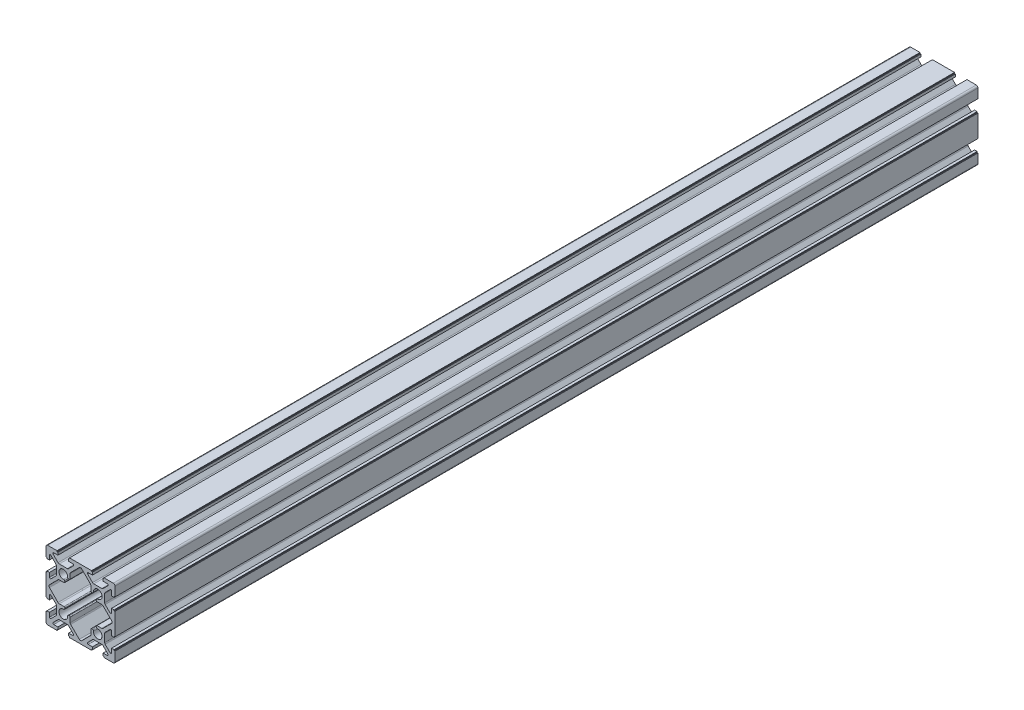
from build123d import *

# Parameters (mm, degrees)
EXTRUDE_1_DEPTH = 500


with BuildPart() as part:
    # 草图1 → 拉伸1 (new body)
    with BuildSketch(Plane.XY):
        with BuildLine():
            Line((29.173779204, 25.880575365), (26.320225813, 23.027021974))
            ThreePointArc((26.320225813, 23.027021974), (26.211839437, 22.482126867), (26.673779204, 22.173468583))
            Line((26.673779204, 22.173468583), (29.093880252, 22.173468583))
            Line((29.093880252, 22.173468583), (29.093880252, 20.673468583))
            Line((29.093880252, 20.673468583), (28.593880252, 20.673468583))
            Line((28.593880252, 20.673468583), (28.593880252, 20.173468583))
            Line((28.593880252, 20.173468583), (15.793880216, 20.173468583))
            Line((15.793880216, 20.173468583), (15.793880216, 20.673468583))
            Line((15.793880216, 20.673468583), (15.293880216, 20.673468583))
            Line((15.293880216, 20.673468583), (15.293880216, 22.173468583))
            Line((15.293880216, 22.173468583), (17.713981229, 22.173468583))
            ThreePointArc((17.713981229, 22.173468583), (18.175920995, 22.482126867), (18.06753462, 23.027021974))
            Line((18.06753462, 23.027021974), (15.213981229, 25.880575365))
            ThreePointArc((15.213981229, 25.880575365), (14.88955788, 26.097348116), (14.506874448, 26.173468583))
            Line((14.506874448, 26.173468583), (9.880885985, 26.173468583))
            ThreePointArc((9.880885985, 26.173468583), (9.498202552, 26.097348116), (9.173779204, 25.880575365))
            Line((9.173779204, 25.880575365), (6.320225813, 23.027021974))
            ThreePointArc((6.320225813, 23.027021974), (6.211839437, 22.482126867), (6.673779204, 22.173468583))
            Line((6.673779204, 22.173468583), (9.093880216, 22.173468583))
            Line((9.093880216, 22.173468583), (9.093880216, 20.673468583))
            Line((9.093880216, 20.673468583), (8.593880216, 20.673468583))
            Line((8.593880216, 20.673468583), (8.593880216, 20.173468583))
            Line((8.593880216, 20.173468583), (3.193880216, 20.173468583))
            ThreePointArc((3.193880216, 20.173468583), (2.486773435, 20.466361802), (2.193880216, 21.173468583))
            Line((2.193880216, 21.173468583), (2.193880216, 26.573468583))
            Line((2.193880216, 26.573468583), (2.693880216, 26.573468583))
            Line((2.693880216, 26.573468583), (2.693880216, 27.073468583))
            Line((2.693880216, 27.073468583), (4.193880216, 27.073468583))
            Line((4.193880216, 27.073468583), (4.193880216, 24.653367607))
            ThreePointArc((4.193880216, 24.653367607), (4.5025385, 24.191427841), (5.047433607, 24.299814216))
            Line((5.047433607, 24.299814216), (7.900986997, 27.153367607))
            ThreePointArc((7.900986997, 27.153367607), (8.117759749, 27.477790956), (8.193880216, 27.860474388))
            Line((8.193880216, 27.860474388), (8.193880216, 32.486462851))
            ThreePointArc((8.193880216, 32.486462851), (8.117759749, 32.869146283), (7.900986997, 33.193569632))
            Line((7.900986997, 33.193569632), (5.047433607, 36.047123023))
            ThreePointArc((5.047433607, 36.047123023), (4.5025385, 36.155509398), (4.193880216, 35.693569632))
            Line((4.193880216, 35.693569632), (4.193880216, 33.273468583))
            Line((4.193880216, 33.273468583), (2.693880216, 33.273468583))
            Line((2.693880216, 33.273468583), (2.693880216, 33.773468583))
            Line((2.693880216, 33.773468583), (2.193880216, 33.773468583))
            Line((2.193880216, 33.773468583), (2.193880216, 46.57346862))
            Line((2.193880216, 46.57346862), (2.693880216, 46.57346862))
            Line((2.693880216, 46.57346862), (2.693880216, 47.07346862))
            Line((2.693880216, 47.07346862), (4.193880216, 47.07346862))
            Line((4.193880216, 47.07346862), (4.193880216, 44.653367607))
            ThreePointArc((4.193880216, 44.653367607), (4.5025385, 44.191427841), (5.047433607, 44.299814216))
            Line((5.047433607, 44.299814216), (7.900986997, 47.153367607))
            ThreePointArc((7.900986997, 47.153367607), (8.117759749, 47.477790956), (8.193880216, 47.860474388))
            Line((8.193880216, 47.860474388), (8.193880216, 52.486462851))
            ThreePointArc((8.193880216, 52.486462851), (8.117759749, 52.869146283), (7.900986997, 53.193569632))
            Line((7.900986997, 53.193569632), (5.047433607, 56.047123023))
            ThreePointArc((5.047433607, 56.047123023), (4.5025385, 56.155509398), (4.193880216, 55.693569632))
            Line((4.193880216, 55.693569632), (4.193880216, 53.27346862))
            Line((4.193880216, 53.27346862), (2.693880216, 53.27346862))
            Line((2.693880216, 53.27346862), (2.693880216, 53.77346862))
            Line((2.693880216, 53.77346862), (2.193880216, 53.77346862))
            Line((2.193880216, 53.77346862), (2.193880216, 59.17346862))
            ThreePointArc((2.193880216, 59.17346862), (2.486773435, 59.880575401), (3.193880216, 60.17346862))
            Line((3.193880216, 60.17346862), (8.593880216, 60.17346862))
            Line((8.593880216, 60.17346862), (8.593880216, 59.67346862))
            Line((8.593880216, 59.67346862), (9.093880216, 59.67346862))
            Line((9.093880216, 59.67346862), (9.093880216, 58.17346862))
            Line((9.093880216, 58.17346862), (6.673779204, 58.17346862))
            ThreePointArc((6.673779204, 58.17346862), (6.211839437, 57.864810336), (6.320225813, 57.319915229))
            Line((6.320225813, 57.319915229), (9.173779204, 54.466361838))
            ThreePointArc((9.173779204, 54.466361838), (9.498202552, 54.249589087), (9.880885985, 54.17346862))
            Line((9.880885985, 54.17346862), (14.506874448, 54.17346862))
            ThreePointArc((14.506874448, 54.17346862), (14.88955788, 54.249589087), (15.213981229, 54.466361838))
            Line((15.213981229, 54.466361838), (18.06753462, 57.319915229))
            ThreePointArc((18.06753462, 57.319915229), (18.175920995, 57.864810336), (17.713981229, 58.17346862))
            Line((17.713981229, 58.17346862), (15.293880216, 58.17346862))
            Line((15.293880216, 58.17346862), (15.293880216, 59.67346862))
            Line((15.293880216, 59.67346862), (15.793880216, 59.67346862))
            Line((15.793880216, 59.67346862), (15.793880216, 60.17346862))
            Line((15.793880216, 60.17346862), (28.593880252, 60.17346862))
            Line((28.593880252, 60.17346862), (28.593880252, 59.67346862))
            Line((28.593880252, 59.67346862), (29.093880252, 59.67346862))
            Line((29.093880252, 59.67346862), (29.093880252, 58.17346862))
            Line((29.093880252, 58.17346862), (26.673779204, 58.17346862))
            ThreePointArc((26.673779204, 58.17346862), (26.211839437, 57.864810336), (26.320225813, 57.319915229))
            Line((26.320225813, 57.319915229), (29.173779204, 54.466361838))
            ThreePointArc((29.173779204, 54.466361838), (29.498202552, 54.249589087), (29.880885985, 54.17346862))
            Line((29.880885985, 54.17346862), (34.506874448, 54.17346862))
            ThreePointArc((34.506874448, 54.17346862), (34.88955788, 54.249589087), (35.213981229, 54.466361838))
            Line((35.213981229, 54.466361838), (38.06753462, 57.319915229))
            ThreePointArc((38.06753462, 57.319915229), (38.175920995, 57.864810336), (37.713981229, 58.17346862))
            Line((37.713981229, 58.17346862), (35.293880216, 58.17346862))
            Line((35.293880216, 58.17346862), (35.293880216, 59.67346862))
            Line((35.293880216, 59.67346862), (35.793880216, 59.67346862))
            Line((35.793880216, 59.67346862), (35.793880216, 60.17346862))
            Line((35.793880216, 60.17346862), (41.193880216, 60.17346862))
            ThreePointArc((41.193880216, 60.17346862), (41.900986997, 59.880575401), (42.193880216, 59.17346862))
            Line((42.193880216, 59.17346862), (42.193880216, 53.77346862))
            Line((42.193880216, 53.77346862), (41.693880216, 53.77346862))
            Line((41.693880216, 53.77346862), (41.693880216, 53.27346862))
            Line((41.693880216, 53.27346862), (40.193880216, 53.27346862))
            Line((40.193880216, 53.27346862), (40.193880216, 55.693569632))
            ThreePointArc((40.193880216, 55.693569632), (39.885221932, 56.155509398), (39.340326826, 56.047123023))
            Line((39.340326826, 56.047123023), (36.486773435, 53.193569632))
            ThreePointArc((36.486773435, 53.193569632), (36.270000684, 52.869146283), (36.193880216, 52.486462851))
            Line((36.193880216, 52.486462851), (36.193880216, 47.860474388))
            ThreePointArc((36.193880216, 47.860474388), (36.270000684, 47.477790956), (36.486773435, 47.153367607))
            Line((36.486773435, 47.153367607), (39.340326826, 44.299814216))
            ThreePointArc((39.340326826, 44.299814216), (39.885221932, 44.191427841), (40.193880216, 44.653367607))
            Line((40.193880216, 44.653367607), (40.193880216, 47.07346862))
            Line((40.193880216, 47.07346862), (41.693880216, 47.07346862))
            Line((41.693880216, 47.07346862), (41.693880216, 46.57346862))
            Line((41.693880216, 46.57346862), (42.193880216, 46.57346862))
            Line((42.193880216, 46.57346862), (42.193880216, 33.773468583))
            Line((42.193880216, 33.773468583), (41.693880216, 33.773468583))
            Line((41.693880216, 33.773468583), (41.693880216, 33.273468583))
            Line((41.693880216, 33.273468583), (40.193880216, 33.273468583))
            Line((40.193880216, 33.273468583), (40.193880216, 35.693569632))
            ThreePointArc((40.193880216, 35.693569632), (39.885221932, 36.155509398), (39.340326826, 36.047123023))
            Line((39.340326826, 36.047123023), (36.486773435, 33.193569632))
            ThreePointArc((36.486773435, 33.193569632), (36.270000684, 32.869146283), (36.193880216, 32.486462851))
            Line((36.193880216, 32.486462851), (36.193880216, 27.860474388))
            ThreePointArc((36.193880216, 27.860474388), (36.270000684, 27.477790956), (36.486773435, 27.153367607))
            Line((36.486773435, 27.153367607), (39.340326826, 24.299814216))
            ThreePointArc((39.340326826, 24.299814216), (39.885221932, 24.191427841), (40.193880216, 24.653367607))
            Line((40.193880216, 24.653367607), (40.193880216, 27.073468583))
            Line((40.193880216, 27.073468583), (41.693880216, 27.073468583))
            Line((41.693880216, 27.073468583), (41.693880216, 26.573468583))
            Line((41.693880216, 26.573468583), (42.193880216, 26.573468583))
            Line((42.193880216, 26.573468583), (42.193880216, 21.173468583))
            ThreePointArc((42.193880216, 21.173468583), (41.900986997, 20.466361802), (41.193880216, 20.173468583))
            Line((41.193880216, 20.173468583), (35.793880216, 20.173468583))
            Line((35.793880216, 20.173468583), (35.793880216, 20.673468583))
            Line((35.793880216, 20.673468583), (35.293880216, 20.673468583))
            Line((35.293880216, 20.673468583), (35.293880216, 22.173468583))
            Line((35.293880216, 22.173468583), (37.713981229, 22.173468583))
            ThreePointArc((37.713981229, 22.173468583), (38.175920995, 22.482126867), (38.06753462, 23.027021974))
            Line((38.06753462, 23.027021974), (35.213981229, 25.880575365))
            ThreePointArc((35.213981229, 25.880575365), (34.88955788, 26.097348116), (34.506874448, 26.173468583))
            Line((34.506874448, 26.173468583), (29.880885985, 26.173468583))
            ThreePointArc((29.880885985, 26.173468583), (29.498202552, 26.097348116), (29.173779204, 25.880575365))
        make_face()
        with BuildLine():
            Line((31.428283161, 33.030715769), (31.290733225, 33.54405912))
            ThreePointArc((31.290733225, 33.54405912), (31.377019468, 33.977849357), (31.773696138, 34.173468643))
            Line((31.773696138, 34.173468643), (34.506874453, 34.173468643))
            ThreePointArc((34.506874453, 34.173468643), (34.889557885, 34.24958911), (35.213981234, 34.466361862))
            Line((35.213981234, 34.466361862), (40.213981229, 39.466361856))
            ThreePointArc((40.213981229, 39.466361856), (40.506874448, 40.173468638), (40.213981229, 40.880575419))
            Line((40.213981229, 40.880575419), (35.213981224, 45.880575424))
            ThreePointArc((35.213981224, 45.880575424), (34.889557875, 46.097348175), (34.506874443, 46.173468643))
            Line((34.506874443, 46.173468643), (31.773696128, 46.173468643))
            ThreePointArc((31.773696128, 46.173468643), (31.377019458, 46.369087928), (31.290733215, 46.802878165))
            Line((31.290733215, 46.802878165), (31.428283151, 47.316221516))
            ThreePointArc((31.428283151, 47.316221516), (31.625910534, 47.597401369), (31.958351755, 47.684588102))
            ThreePointArc((31.958351755, 47.684588102), (33.961647164, 51.941235596), (29.70499967, 49.937940187))
            ThreePointArc((29.70499967, 49.937940187), (29.617812937, 49.605498966), (29.336633085, 49.407871583))
            Line((29.336633085, 49.407871583), (28.823289734, 49.270321646))
            ThreePointArc((28.823289734, 49.270321646), (28.389499497, 49.356607889), (28.193880211, 49.75328456))
            Line((28.193880211, 49.75328456), (28.193880211, 52.486462874))
            ThreePointArc((28.193880211, 52.486462874), (28.117759744, 52.869146307), (27.900986992, 53.193569656))
            Line((27.900986992, 53.193569656), (22.900987001, 58.193569646))
            ThreePointArc((22.900987001, 58.193569646), (22.19388022, 58.486462865), (21.486773439, 58.193569646))
            Line((21.486773439, 58.193569646), (16.48677343, 53.193569637))
            ThreePointArc((16.48677343, 53.193569637), (16.270000679, 52.869146289), (16.193880211, 52.486462856))
            Line((16.193880211, 52.486462856), (16.193880211, 49.753284541))
            ThreePointArc((16.193880211, 49.753284541), (15.998260926, 49.356607871), (15.564470689, 49.270321628))
            Line((15.564470689, 49.270321628), (15.051127338, 49.407871565))
            ThreePointArc((15.051127338, 49.407871565), (14.769947485, 49.605498947), (14.682760752, 49.937940169))
            ThreePointArc((14.682760752, 49.937940169), (10.426113258, 51.941235578), (12.429408667, 47.684588084))
            ThreePointArc((12.429408667, 47.684588084), (12.761849888, 47.597401351), (12.959477271, 47.316221498))
            Line((12.959477271, 47.316221498), (13.097027208, 46.802878147))
            ThreePointArc((13.097027208, 46.802878147), (13.010740965, 46.36908791), (12.614064294, 46.173468625))
            Line((12.614064294, 46.173468625), (9.88088598, 46.173468625))
            ThreePointArc((9.88088598, 46.173468625), (9.498202547, 46.097348157), (9.173779198, 45.880575406))
            Line((9.173779198, 45.880575406), (4.173779204, 40.880575411))
            ThreePointArc((4.173779204, 40.880575411), (3.880885985, 40.17346863), (4.173779204, 39.466361849))
            Line((4.173779204, 39.466361849), (9.173779209, 34.466361844))
            ThreePointArc((9.173779209, 34.466361844), (9.498202558, 34.249589092), (9.88088599, 34.173468625))
            Line((9.88088599, 34.173468625), (12.614064305, 34.173468625))
            ThreePointArc((12.614064305, 34.173468625), (13.010740975, 33.977849339), (13.097027218, 33.544059102))
            Line((13.097027218, 33.544059102), (12.959477282, 33.030715751))
            ThreePointArc((12.959477282, 33.030715751), (12.761849899, 32.749535898), (12.429408677, 32.662349166))
            ThreePointArc((12.429408677, 32.662349166), (10.426113269, 28.405701672), (14.682760762, 30.408997081))
            ThreePointArc((14.682760762, 30.408997081), (14.769947495, 30.741438302), (15.051127348, 30.939065685))
            Line((15.051127348, 30.939065685), (15.564470699, 31.076615621))
            ThreePointArc((15.564470699, 31.076615621), (15.998260936, 30.990329378), (16.193880222, 30.593652708))
            Line((16.193880222, 30.593652708), (16.193880222, 27.860474393))
            ThreePointArc((16.193880222, 27.860474393), (16.270000689, 27.477790961), (16.48677344, 27.153367612))
            Line((16.48677344, 27.153367612), (21.486773431, 22.153367621))
            ThreePointArc((21.486773431, 22.153367621), (22.193880212, 21.860474402), (22.900986994, 22.153367621))
            Line((22.900986994, 22.153367621), (27.900987003, 27.15336763))
            ThreePointArc((27.900987003, 27.15336763), (28.117759754, 27.477790979), (28.193880222, 27.860474411))
            Line((28.193880222, 27.860474411), (28.193880222, 30.593652726))
            ThreePointArc((28.193880222, 30.593652726), (28.389499507, 30.990329396), (28.823289744, 31.076615639))
            Line((28.823289744, 31.076615639), (29.336633095, 30.939065703))
            ThreePointArc((29.336633095, 30.939065703), (29.617812948, 30.74143832), (29.704999681, 30.408997099))
            ThreePointArc((29.704999681, 30.408997099), (33.961647174, 28.40570169), (31.958351766, 32.662349184))
            ThreePointArc((31.958351766, 32.662349184), (31.625910544, 32.749535916), (31.428283161, 33.030715769))
        make_face(mode=Mode.SUBTRACT)
    extrude(amount=EXTRUDE_1_DEPTH)


solid = part.part
